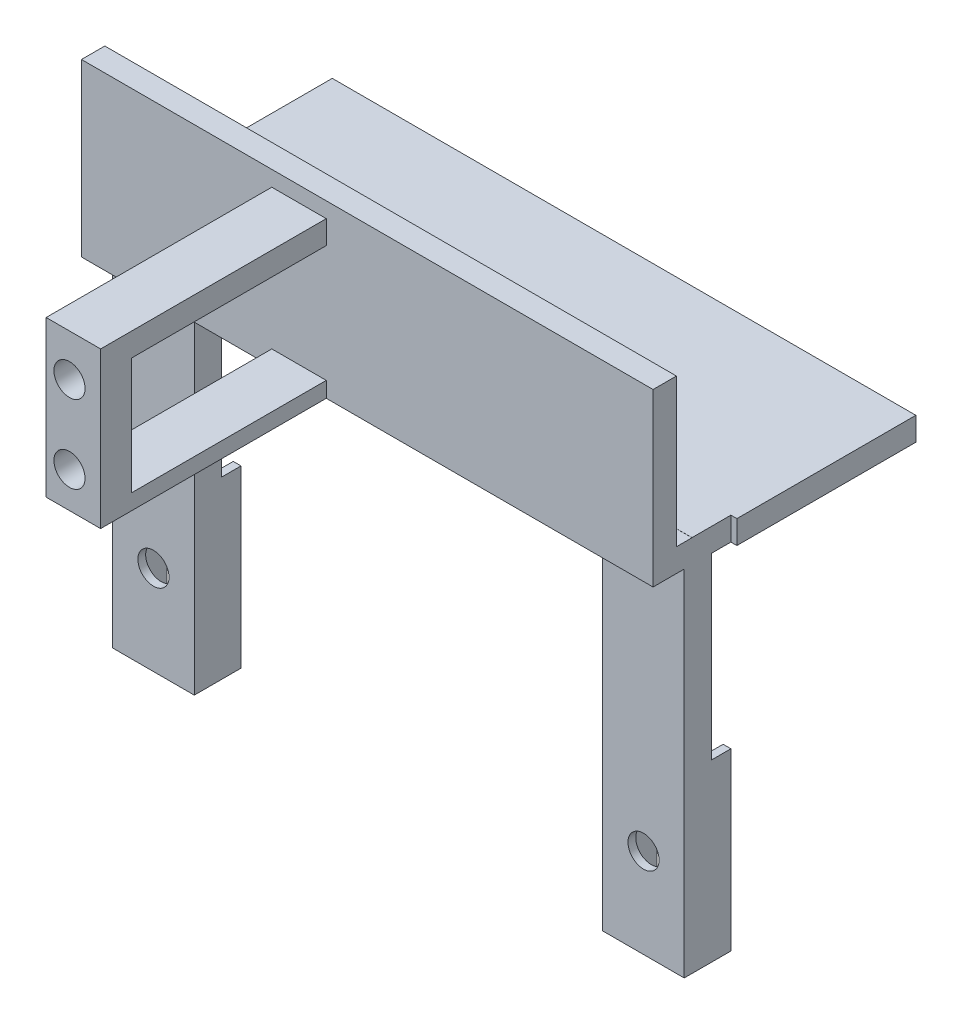
from build123d import *

# Parameters (mm, degrees)
SKETCH1_W            = 75
SKETCH1_H            = 23
BOSS_EXTRUDE1_DEPTH  = 3
BOSS_EXTRUDE4_DEPTH  = 5
SKETCH3_W            = 10.5
SKETCH3_H            = 1
BOSS_EXTRUDE5_DEPTH  = 48.5
SKETCH4_R            = 2
CUT_EXTRUDE1_DEPTH   = 66.282886378
SKETCH8_W            = 73.460514862
SKETCH8_H            = 2.985109538
BOSS_EXTRUDE9_DEPTH  = 10
SKETCH12_W           = 73.460514862
SKETCH12_H           = 3
BOSS_EXTRUDE10_DEPTH = 19
SKETCH13_W           = 7
SKETCH13_H           = 20
BOSS_EXTRUDE11_DEPTH = 29
SKETCH14_R           = 2
CUT_EXTRUDE2_DEPTH   = 10
SKETCH15_W           = 2.5
SKETCH15_H           = 23
CUT_EXTRUDE3_DEPTH   = 101.657768563
SKETCH17_W           = 25
SKETCH17_H           = 15
CUT_EXTRUDE4_DEPTH   = 85.254866502


with BuildPart() as part:
    # Sketch1 → Boss-Extrude1 (new body)
    with BuildSketch(Plane(origin=(0, 0, 0), x_dir=(1, 0, 0), z_dir=(0, 1, 0))):
        Rectangle(SKETCH1_W, SKETCH1_H)
    extrude(amount=BOSS_EXTRUDE1_DEPTH)

    # Sketch2 → Boss-Extrude4 (add)
    with BuildSketch(Plane.XY.offset(11.5)):
        Polygon((27.230257431, 0), (27.230257431, -45.514890462), (26.230257431, -45.514890462), (26.230257431, 3), (36.730257431, 3), (36.730257431, -45.514890462), (35.730257431, -45.514890462), (35.730257431, 0), align=None)
        Polygon((-35.730257431, -45.514890462), (-36.730257431, -45.514890462), (-36.730257431, 3), (-26.230257431, 3), (-26.230257431, -45.514890462), (-27.230257431, -45.514890462), (-27.230257431, 0), (-35.730257431, 0), align=None)
    extrude(amount=BOSS_EXTRUDE4_DEPTH)

    # Sketch3 → Boss-Extrude5 (add)
    with BuildSketch(Plane.XZ.offset(45.514890462)):
        with Locations((-31.480257431, 17)):
            Rectangle(SKETCH3_W, SKETCH3_H)
        with Locations((31.480257431, 17)):
            Rectangle(SKETCH3_W, SKETCH3_H)
    extrude(amount=-BOSS_EXTRUDE5_DEPTH)

    # Sketch4 → Cut-Extrude1 (cut, through all)
    with BuildSketch(Plane(origin=(0, 0, 16.5), x_dir=(-1, 0, 0), z_dir=(0, 0, -1))):
        with Locations((31.481258109, -34.012149814)):
            Circle(SKETCH4_R)
        with Locations((-31.503449984, -34.014890462)):
            Circle(SKETCH4_R)
    extrude(amount=-CUT_EXTRUDE1_DEPTH, mode=Mode.SUBTRACT)

    # Sketch8 → Boss-Extrude9 (add)
    with BuildSketch(Plane.XY.offset(11.5)):
        with Locations((0, 1.492554769)):
            Rectangle(SKETCH8_W, SKETCH8_H)
    extrude(amount=BOSS_EXTRUDE9_DEPTH)

    # Sketch12 → Boss-Extrude10 (add)
    with BuildSketch(Plane(origin=(0, 2.985109538, 0), x_dir=(1, 0, 0), z_dir=(0, 1, 0))):
        with Locations((0, -20)):
            Rectangle(SKETCH12_W, SKETCH12_H)
    extrude(amount=BOSS_EXTRUDE10_DEPTH)

    # Sketch13 → Boss-Extrude11 (add)
    with BuildSketch(Plane.XY.offset(21.5)):
        with Locations((-8.769742569, 10)):
            Rectangle(SKETCH13_W, SKETCH13_H)
    extrude(amount=BOSS_EXTRUDE11_DEPTH)

    # Sketch14 → Cut-Extrude2 (cut)
    with BuildSketch(Plane.XY.offset(50.5)):
        with Locations((-9.269742569, 14.59)):
            Circle(SKETCH14_R)
        with Locations((-9.269742569, 4.59)):
            Circle(SKETCH14_R)
    extrude(amount=-CUT_EXTRUDE2_DEPTH, mode=Mode.SUBTRACT)

    # Sketch15 → Cut-Extrude3 (cut, through all)
    with BuildSketch(Plane.ZY.offset(36.730257431)):
        with Locations((12.75, -11.5)):
            Rectangle(SKETCH15_W, SKETCH15_H)
    extrude(amount=-CUT_EXTRUDE3_DEPTH, mode=Mode.SUBTRACT)

    # Sketch17 → Cut-Extrude4 (cut, through all)
    with BuildSketch(Plane.ZY.offset(12.269742569)):
        with Locations((34, 9.5)):
            Rectangle(SKETCH17_W, SKETCH17_H)
    extrude(amount=-CUT_EXTRUDE4_DEPTH, mode=Mode.SUBTRACT)


solid = part.part
